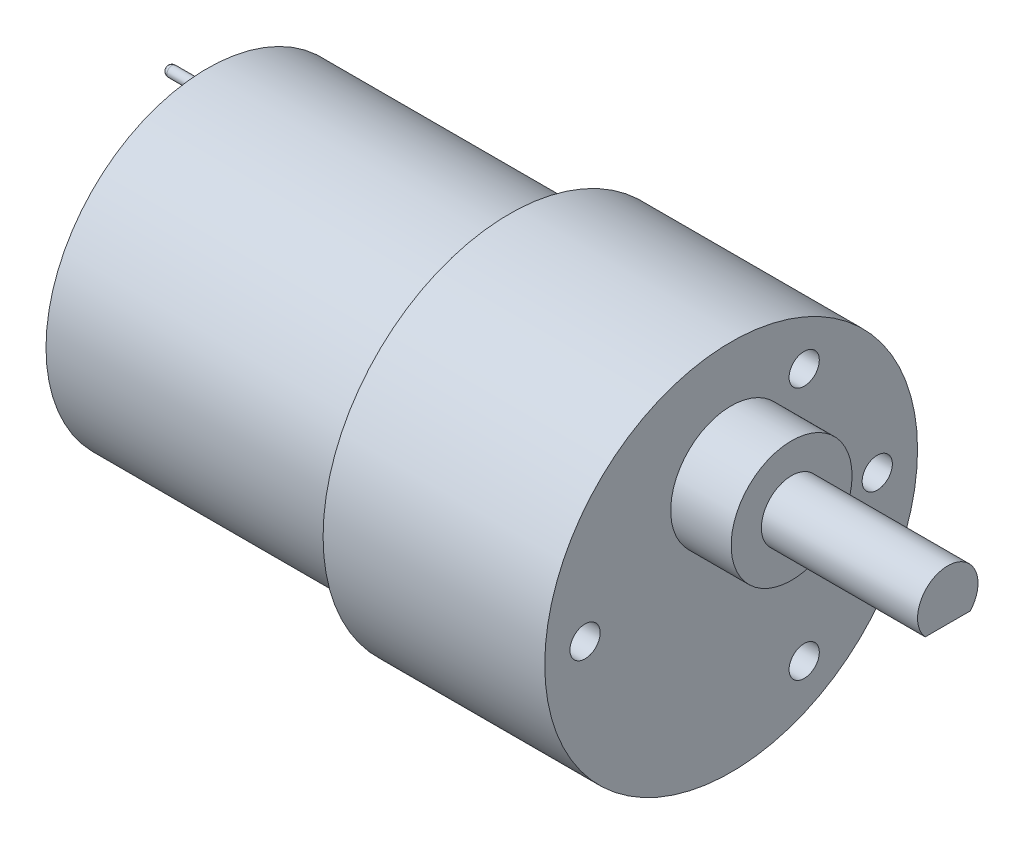
from build123d import *

# Parameters (mm, degrees)
SKETCH2_R           = 2
BOSS_EXTRUDE1_DEPTH = 2
FILLET3_R           = 2
SKETCH3_R           = 6
BOSS_EXTRUDE2_DEPTH = 6
SKETCH4_R           = 3
BOSS_EXTRUDE3_DEPTH = 15.5
CUT_EXTRUDE1_START  = -12
CUT_EXTRUDE1_DEPTH  = 12
SKETCH6_R           = 1.5
CUT_EXTRUDE2_DEPTH  = 5
SKETCH7_R           = 1.5
CUT_EXTRUDE3_DEPTH  = 5
SKETCH9_R           = 0.5
BOSS_EXTRUDE4_DEPTH = 4
FILLET4_R           = 0.5


with BuildPart() as part:
    # Sketch1 → Revolve1 (revolve)
    with BuildSketch(Plane(origin=(0, 0, 0), x_dir=(1, 0, 0), z_dir=(0, 1, 0)), mode=Mode.PRIVATE) as revolve1_sk:
        Polygon((52, 18.5), (52, 0), (0, 0), (0, 16), (30, 16), (30, 18.5), align=None)
    revolve(revolve1_sk.sketch.rotate(Axis((0, 0, 0), (1, 0, 0)), 180), axis=Axis((0, 0, 0), (1, 0, 0)))

    # Sketch2 → Boss-Extrude1 (add)
    with BuildSketch(Plane.ZY):
        Circle(SKETCH2_R)
    extrude(amount=BOSS_EXTRUDE1_DEPTH)

    # Fillet3
    fillet3_edges = [part.edges().sort_by_distance(p)[0] for p in [
        (-2, 0, -2),
    ]]
    fillet(fillet3_edges, radius=FILLET3_R - 0.0001)  # a hair under: the kernel refuses the full size

    # Sketch3 → Boss-Extrude2 (add)
    with BuildSketch(Plane(origin=(52, 0, 0), x_dir=(0, 0, -1), z_dir=(1, 0, 0))):
        with Locations((0, 7)):
            Circle(SKETCH3_R)
    extrude(amount=BOSS_EXTRUDE2_DEPTH)

    # Sketch4 → Boss-Extrude3 (add)
    with BuildSketch(Plane(origin=(58, 0, 0), x_dir=(0, 0, -1), z_dir=(1, 0, 0))):
        with Locations((0, 7)):
            Circle(SKETCH4_R)
    extrude(amount=BOSS_EXTRUDE3_DEPTH)

    # Sketch5 → Cut-Extrude1 (cut)
    with BuildSketch(Plane(origin=(73.5, 0, 0), x_dir=(0, 0, -1), z_dir=(1, 0, 0)).offset(CUT_EXTRUDE1_START)):
        with BuildLine():
            ThreePointArc((-2.236067977, 5), (-1.224744871, 4.261387212), (0, 4))
            Line((0, 4), (0, 5))
            Line((0, 5), (-2.236067977, 5))
        make_face()
        with BuildLine():
            Line((0, 5), (0, 4))
            ThreePointArc((0, 4), (1.224744871, 4.261387212), (2.236067977, 5))
            Line((2.236067977, 5), (0, 5))
        make_face()
    extrude(amount=CUT_EXTRUDE1_DEPTH, mode=Mode.SUBTRACT)

    # Sketch6 → Cut-Extrude2 (cut)
    with BuildSketch(Plane(origin=(52, 0, 0), x_dir=(0, 0, -1), z_dir=(1, 0, 0))):
        with Locations((-14.5, 0)):
            Circle(SKETCH6_R)
        with Locations((7.25, 12.557368355)):
            Circle(SKETCH6_R)
        with Locations((7.25, -12.557368355)):
            Circle(SKETCH6_R)
    extrude(amount=-CUT_EXTRUDE2_DEPTH, mode=Mode.SUBTRACT)

    # Sketch7 → Cut-Extrude3 (cut)
    with BuildSketch(Plane(origin=(52, 0, 0), x_dir=(0, 0, -1), z_dir=(1, 0, 0))):
        with Locations((14.5, 0)):
            Circle(SKETCH7_R)
    extrude(amount=-CUT_EXTRUDE3_DEPTH, mode=Mode.SUBTRACT)

    # Sketch9 → Boss-Extrude4 (add)
    with BuildSketch(Plane.ZY):
        with Locations((0, 14)):
            Circle(SKETCH9_R)
        with Locations((0, -14)):
            Circle(SKETCH9_R)
    extrude(amount=BOSS_EXTRUDE4_DEPTH)

    # Fillet4
    fillet4_edges = [part.edges().sort_by_distance(p)[0] for p in [
        (-4, 14, -0.5),
        (-4, -14, -0.5),
    ]]
    fillet(fillet4_edges, radius=FILLET4_R)


solid = part.part
